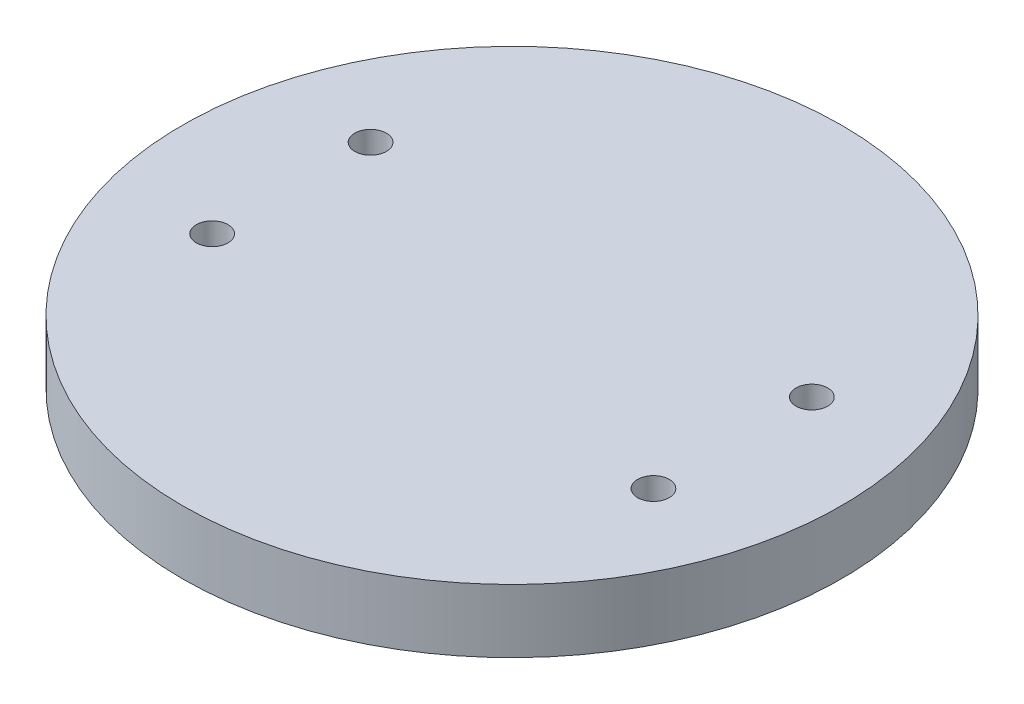
from build123d import *

# Parameters (mm, degrees)
SKETCH1_R           = 66.04
BOSS_EXTRUDE1_DEPTH = 12.7
SKETCH2_R           = 3.175
CUT_EXTRUDE1_DEPTH  = 95.254194602


with BuildPart() as part:
    # Sketch1 → Boss-Extrude1 (new body)
    with BuildSketch(Plane(origin=(0, 0, 0), x_dir=(1, 0, 0), z_dir=(0, 1, 0))):
        Circle(SKETCH1_R)
    extrude(amount=BOSS_EXTRUDE1_DEPTH)

    # Sketch2 → Cut-Extrude1 (cut, through all)
    with BuildSketch(Plane(origin=(0, 12.7, 0), x_dir=(1, 0, 0), z_dir=(0, 1, 0))):
        with Locations((-44.214813621, 15.875)):
            Circle(SKETCH2_R)
        with Locations((-44.214813621, -15.875)):
            Circle(SKETCH2_R)
        with Locations((44.214813621, -15.875)):
            Circle(SKETCH2_R)
        with Locations((44.214813621, 15.875)):
            Circle(SKETCH2_R)
    extrude(amount=-CUT_EXTRUDE1_DEPTH, mode=Mode.SUBTRACT)


solid = part.part
